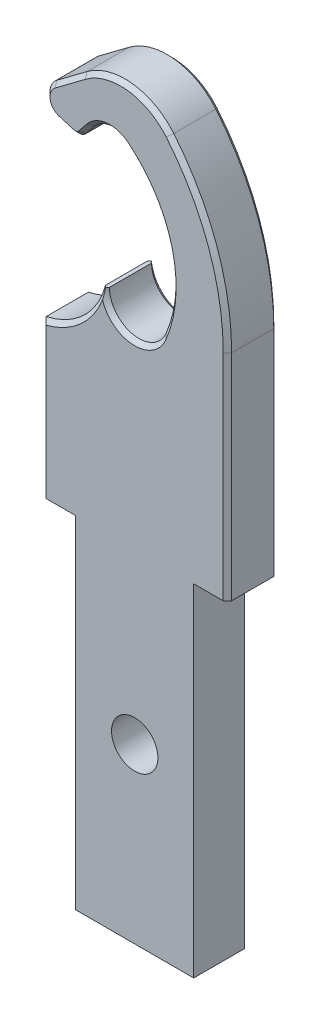
from build123d import *

# Parameters (mm, degrees)
SKETCH_1_R      = 27.5
EXTRUDE_1_DEPTH = 30
CHAMFER_1_SIZE  = 5


with BuildPart() as part:
    # 草图1 → 凸台-拉伸1 (new, symmetric)
    with BuildSketch(Plane.XY):
        with BuildLine():
            Line((140, 405), (180, 405))
            Line((180, 405), (180, 659.74236495))
            ThreePointArc((180, 659.74236495), (162.31188427, 761.231280601), (111.333333333, 850.752545017))
            ThreePointArc((111.333333333, 850.752545017), (62.369816768, 877.473662126), (8.5, 863))
            Line((8.5, 863), (-27.5, 836))
            ThreePointArc((-27.5, 836), (-35.196294357, 816.527826528), (-21.305524623, 800.861142044))
            Line((-21.305524623, 800.861142044), (-3.402762311, 795.430571022))
            ThreePointArc((-3.402762311, 795.430571022), (2.420792013, 795.436058657), (7.253794336, 798.685043674))
            Line((7.253794336, 798.685043674), (17.238616993, 810.944868978))
            ThreePointArc((17.238616993, 810.944868978), (37.541078237, 821.853723084), (59.589937945, 815.142477595))
            ThreePointArc((59.589937945, 815.142477595), (109.84673197, 735.06182538), (102.218185324, 640.825624899))
            ThreePointArc((102.218185324, 640.825624899), (63.022768685, 620.202503835), (35, 654.5))
            Line((35, 654.5), (30.481942633, 654.5))
            ThreePointArc((30.481942633, 654.5), (4.791252117, 610.80152605), (-40, 587.067332603))
            Line((-40, 587.067332603), (-40, 405))
            Line((-40, 405), (0, 405))
            Line((0, 405), (0, 0))
            Line((0, 0), (140, 0))
            Line((140, 0), (140, 405))
        make_face()
        with Locations((70, 205)):
            Circle(SKETCH_1_R, mode=Mode.SUBTRACT)
    extrude(amount=EXTRUDE_1_DEPTH, both=True)

    # 倒角1
    # the kernel refuses this chamfer: 5 mm, written as the material it takes off along each edge
    with BuildSketch(Plane(origin=(-59.5, 678, -30), x_dir=(0.9931437230377144, -0.11689972365573639, 0), z_dir=(0.11689972365573639, 0.9931437230377144, 0))) as chamfer_1_piece_1:
        Polygon((93, -CHAMFER_1_SIZE), (93 + CHAMFER_1_SIZE, 0), (93, 0), align=None)
    revolve(axis=Axis((-59.5, 678, -30), (0, 0, -1)), revolution_arc=79.106771972, mode=Mode.SUBTRACT)
    with BuildSketch(Plane(origin=(-59.5, 678, 30), x_dir=(0.9931437230377144, -0.11689972365573639, 0), z_dir=(0.11689972365573639, 0.9931437230377144, 0))) as chamfer_1_piece_2:
        Polygon((93 + CHAMFER_1_SIZE, 0), (93, CHAMFER_1_SIZE), (93, 0), align=None)
    revolve(axis=Axis((-59.5, 678, 30), (0, 0, -1)), revolution_arc=79.106771972, mode=Mode.SUBTRACT)
    with BuildSketch(Plane(origin=(180, 392.14158506, -30), x_dir=(0.0274958766105877, 0, 0.9996219169112968), z_dir=(0, 1, 0))) as chamfer_1_piece_3:
        Polygon((CHAMFER_1_SIZE * 0.999621916911, -CHAMFER_1_SIZE * 0.0274958766106), (-CHAMFER_1_SIZE * 0.0274958766106, -CHAMFER_1_SIZE * 0.999621916911), (0, 0), align=None)
    extrude(amount=267.60077989, mode=Mode.SUBTRACT)
    with BuildSketch(Plane(origin=(-120, 659.74236495, -30), x_dir=(1, 0, 0), z_dir=(0, -1, 0))) as chamfer_1_piece_4:
        Polygon((300, CHAMFER_1_SIZE), (300 - CHAMFER_1_SIZE, 0), (300, 0), align=None)
    revolve(axis=Axis((-120, 659.74236495, -30), (0, 0, 1)), revolution_arc=39.546229231, mode=Mode.SUBTRACT)
    with BuildSketch(Plane(origin=(53.5, 803, -30), x_dir=(0.7711111111111113, 0.6367006002203762, 0), z_dir=(0.6367006002203762, -0.7711111111111113, 0))) as chamfer_1_piece_5:
        Polygon((75, CHAMFER_1_SIZE), (75 - CHAMFER_1_SIZE, 0), (75, 0), align=None)
    revolve(axis=Axis((53.5, 803, -30), (0, 0, 1)), revolution_arc=87.323668415, mode=Mode.SUBTRACT)
    with BuildSketch(Plane(origin=(8.5, 863, -30), x_dir=(-0.01649752596635013, 0.02199670128846693, 0.9996219169112968), z_dir=(-0.8000000000000013, -0.5999999999999984, 0))) as chamfer_1_piece_6:
        Polygon((CHAMFER_1_SIZE * 0.999621916911, -CHAMFER_1_SIZE * 0.0274958766106), (-CHAMFER_1_SIZE * 0.0274958766106, -CHAMFER_1_SIZE * 0.999621916911), (0, 0), align=None)
    extrude(amount=45, mode=Mode.SUBTRACT)
    with BuildSketch(Plane(origin=(-15.5, 820, -30), x_dir=(-0.6000000000000103, 0.7999999999999922, 0), z_dir=(0.7999999999999922, 0.6000000000000103, 0))) as chamfer_1_piece_7:
        Polygon((20, CHAMFER_1_SIZE), (20 - CHAMFER_1_SIZE, 0), (20, 0), align=None)
    revolve(axis=Axis((-15.5, 820, -30), (0, 0, 1)), revolution_arc=126.255608056, mode=Mode.SUBTRACT)
    with BuildSketch(Plane(origin=(-21.305524623, 800.861142044, -30), x_dir=(-0.007981399434105696, -0.02631198384115636, 0.9996219169112971), z_dir=(0.9569428977956573, -0.29027623112898887, 0))) as chamfer_1_piece_8:
        Polygon((CHAMFER_1_SIZE * 0.999621916911, -CHAMFER_1_SIZE * 0.0274958766106), (-CHAMFER_1_SIZE * 0.0274958766106, -CHAMFER_1_SIZE * 0.999621916911), (0, 0), align=None)
    extrude(amount=18.708286934, mode=Mode.SUBTRACT)
    with BuildSketch(Plane(origin=(-0.5, 805, -30), x_dir=(-0.29027623112897577, -0.9569428977956612, 0), z_dir=(-0.9569428977956612, 0.29027623112897577, 0))) as chamfer_1_piece_9:
        Polygon((10, CHAMFER_1_SIZE), (10 - CHAMFER_1_SIZE, 0), (10, 0), align=None)
    revolve(axis=Axis((-0.5, 805, -30), (0, 0, 1)), revolution_arc=67.7139403, mode=Mode.SUBTRACT)
    with BuildSketch(Plane(origin=(7.253794336, 798.685043674, -30), x_dir=(0.021319737231601184, -0.01736352599446127, 0.9996219169112965), z_dir=(0.6314956326132553, 0.7753794335616496, 0))) as chamfer_1_piece_10:
        Polygon((CHAMFER_1_SIZE * 0.999621916911, -CHAMFER_1_SIZE * 0.0274958766106), (-CHAMFER_1_SIZE * 0.0274958766106, -CHAMFER_1_SIZE * 0.999621916911), (0, 0), align=None)
    extrude(amount=15.811388301, mode=Mode.SUBTRACT)
    with BuildSketch(Plane(origin=(40.5, 792, -30), x_dir=(-0.7753794335616501, 0.6314956326132546, 0), z_dir=(-0.6314956326132546, -0.7753794335616501, 0))) as chamfer_1_piece_11:
        Polygon((30, -CHAMFER_1_SIZE), (30 + CHAMFER_1_SIZE, 0), (30, 0), align=None)
    revolve(axis=Axis((40.5, 792, -30), (0, 0, -1)), revolution_arc=90.358237971, mode=Mode.SUBTRACT)
    with BuildSketch(Plane(origin=(-35.85975178, 699.430089618, -30), x_dir=(0.6363312648327024, 0.7714159198489573, 0), z_dir=(-0.7714159198489573, 0.6363312648327024, 0))) as chamfer_1_piece_12:
        Polygon((150, -CHAMFER_1_SIZE), (150 + CHAMFER_1_SIZE, 0), (150, 0), align=None)
    revolve(axis=Axis((-35.85975178, 699.430089618, -30), (0, 0, -1)), revolution_arc=73.479048371, mode=Mode.SUBTRACT)
    with BuildSketch(Plane(origin=(70, 654.5, -30), x_dir=(0.920519580694994, -0.39069643146196303, 0), z_dir=(0.39069643146196303, 0.920519580694994, 0))) as chamfer_1_piece_13:
        Polygon((35, -CHAMFER_1_SIZE), (35 + CHAMFER_1_SIZE, 0), (35, 0), align=None)
    revolve(axis=Axis((70, 654.5, -30), (0, 0, -1)), revolution_arc=178.077418405, mode=Mode.SUBTRACT)
    with BuildSketch(Plane(origin=(180, 392.14158506, 30), x_dir=(0.0274958766105877, 0, -0.9996219169112968), z_dir=(0, 1, 0))) as chamfer_1_piece_14:
        Polygon((CHAMFER_1_SIZE * 0.999621916911, CHAMFER_1_SIZE * 0.0274958766106), (-CHAMFER_1_SIZE * 0.0274958766106, CHAMFER_1_SIZE * 0.999621916911), (0, 0), align=None)
    extrude(amount=267.60077989, mode=Mode.SUBTRACT)
    with BuildSketch(Plane(origin=(-120, 659.74236495, 30), x_dir=(1, 0, 0), z_dir=(0, -1, 0))) as chamfer_1_piece_15:
        Polygon((300, -CHAMFER_1_SIZE), (300 - CHAMFER_1_SIZE, 0), (300, 0), align=None)
    revolve(axis=Axis((-120, 659.74236495, 30), (0, 0, 1)), revolution_arc=39.546229231, mode=Mode.SUBTRACT)
    with BuildSketch(Plane(origin=(53.5, 803, 30), x_dir=(0.7711111111111113, 0.6367006002203762, 0), z_dir=(0.6367006002203762, -0.7711111111111113, 0))) as chamfer_1_piece_16:
        Polygon((75, -CHAMFER_1_SIZE), (75 - CHAMFER_1_SIZE, 0), (75, 0), align=None)
    revolve(axis=Axis((53.5, 803, 30), (0, 0, 1)), revolution_arc=87.323668415, mode=Mode.SUBTRACT)
    with BuildSketch(Plane(origin=(8.5, 863, 30), x_dir=(-0.01649752596635013, 0.02199670128846693, -0.9996219169112968), z_dir=(-0.8000000000000013, -0.5999999999999984, 0))) as chamfer_1_piece_17:
        Polygon((CHAMFER_1_SIZE * 0.999621916911, CHAMFER_1_SIZE * 0.0274958766106), (-CHAMFER_1_SIZE * 0.0274958766106, CHAMFER_1_SIZE * 0.999621916911), (0, 0), align=None)
    extrude(amount=45, mode=Mode.SUBTRACT)
    with BuildSketch(Plane(origin=(-15.5, 820, 30), x_dir=(-0.6000000000000103, 0.7999999999999922, 0), z_dir=(0.7999999999999922, 0.6000000000000103, 0))) as chamfer_1_piece_18:
        Polygon((20, -CHAMFER_1_SIZE), (20 - CHAMFER_1_SIZE, 0), (20, 0), align=None)
    revolve(axis=Axis((-15.5, 820, 30), (0, 0, 1)), revolution_arc=126.255608056, mode=Mode.SUBTRACT)
    with BuildSketch(Plane(origin=(-21.305524623, 800.861142044, 30), x_dir=(-0.007981399434105696, -0.02631198384115636, -0.9996219169112971), z_dir=(0.9569428977956573, -0.29027623112898887, 0))) as chamfer_1_piece_19:
        Polygon((CHAMFER_1_SIZE * 0.999621916911, CHAMFER_1_SIZE * 0.0274958766106), (-CHAMFER_1_SIZE * 0.0274958766106, CHAMFER_1_SIZE * 0.999621916911), (0, 0), align=None)
    extrude(amount=18.708286934, mode=Mode.SUBTRACT)
    with BuildSketch(Plane(origin=(-0.5, 805, 30), x_dir=(-0.29027623112897577, -0.9569428977956612, 0), z_dir=(-0.9569428977956612, 0.29027623112897577, 0))) as chamfer_1_piece_20:
        Polygon((10, -CHAMFER_1_SIZE), (10 - CHAMFER_1_SIZE, 0), (10, 0), align=None)
    revolve(axis=Axis((-0.5, 805, 30), (0, 0, 1)), revolution_arc=67.7139403, mode=Mode.SUBTRACT)
    with BuildSketch(Plane(origin=(7.253794336, 798.685043674, 30), x_dir=(0.021319737231601184, -0.01736352599446127, -0.9996219169112965), z_dir=(0.6314956326132553, 0.7753794335616496, 0))) as chamfer_1_piece_21:
        Polygon((CHAMFER_1_SIZE * 0.999621916911, CHAMFER_1_SIZE * 0.0274958766106), (-CHAMFER_1_SIZE * 0.0274958766106, CHAMFER_1_SIZE * 0.999621916911), (0, 0), align=None)
    extrude(amount=15.811388301, mode=Mode.SUBTRACT)
    with BuildSketch(Plane(origin=(40.5, 792, 30), x_dir=(-0.7753794335616501, 0.6314956326132546, 0), z_dir=(-0.6314956326132546, -0.7753794335616501, 0))) as chamfer_1_piece_22:
        Polygon((30, CHAMFER_1_SIZE), (30 + CHAMFER_1_SIZE, 0), (30, 0), align=None)
    revolve(axis=Axis((40.5, 792, 30), (0, 0, -1)), revolution_arc=90.358237971, mode=Mode.SUBTRACT)
    with BuildSketch(Plane(origin=(-35.85975178, 699.430089618, 30), x_dir=(0.6363312648327024, 0.7714159198489573, 0), z_dir=(-0.7714159198489573, 0.6363312648327024, 0))) as chamfer_1_piece_23:
        Polygon((150, CHAMFER_1_SIZE), (150 + CHAMFER_1_SIZE, 0), (150, 0), align=None)
    revolve(axis=Axis((-35.85975178, 699.430089618, 30), (0, 0, -1)), revolution_arc=73.479048371, mode=Mode.SUBTRACT)
    with BuildSketch(Plane(origin=(70, 654.5, 30), x_dir=(0.920519580694994, -0.39069643146196303, 0), z_dir=(0.39069643146196303, 0.920519580694994, 0))) as chamfer_1_piece_24:
        Polygon((35, CHAMFER_1_SIZE), (35 + CHAMFER_1_SIZE, 0), (35, 0), align=None)
    revolve(axis=Axis((70, 654.5, 30), (0, 0, -1)), revolution_arc=178.077418405, mode=Mode.SUBTRACT)
    with BuildSketch(Plane(origin=(-40, 599.925747542, -30), x_dir=(-0.027495876610586317, 0, 0.9996219169112968), z_dir=(0, -1, 0))) as chamfer_1_piece_25:
        Polygon((CHAMFER_1_SIZE * 0.999621916911, -CHAMFER_1_SIZE * 0.0274958766106), (-CHAMFER_1_SIZE * 0.0274958766106, -CHAMFER_1_SIZE * 0.999621916911), (0, 0), align=None)
    extrude(amount=207.784162482, mode=Mode.SUBTRACT)
    with BuildSketch(Plane(origin=(-40, 599.925747542, 30), x_dir=(-0.027495876610586317, 0, -0.9996219169112968), z_dir=(0, -1, 0))) as chamfer_1_piece_26:
        Polygon((CHAMFER_1_SIZE * 0.999621916911, CHAMFER_1_SIZE * 0.0274958766106), (-CHAMFER_1_SIZE * 0.0274958766106, CHAMFER_1_SIZE * 0.999621916911), (0, 0), align=None)
    extrude(amount=207.784162482, mode=Mode.SUBTRACT)


solid = part.part
